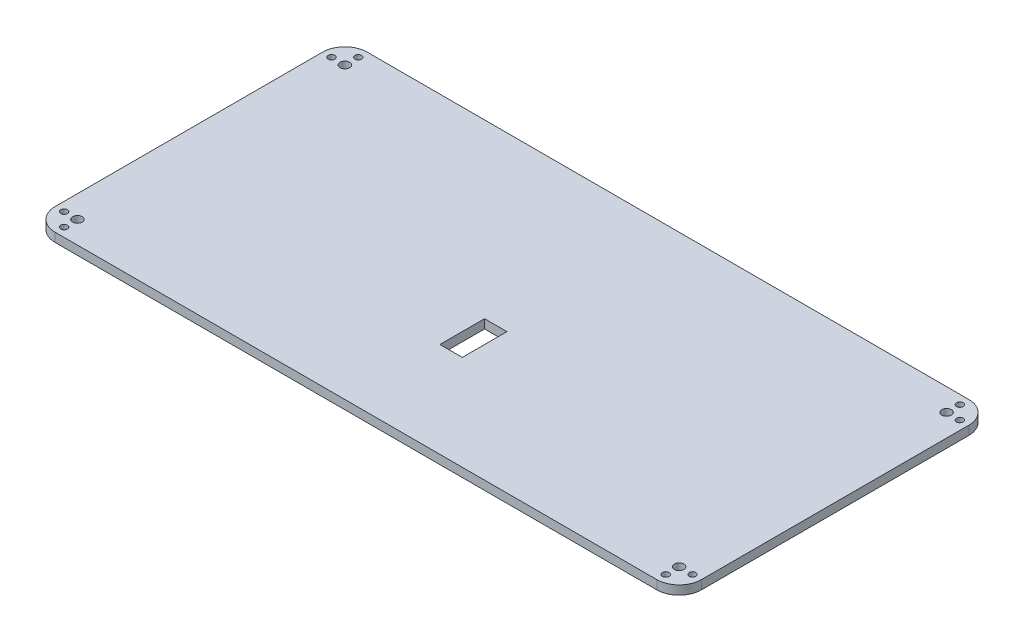
from build123d import *

# Parameters (mm, degrees)
SKETCH1_R               = 1.5
BOSS_EXTRUDE1_DEPTH     = 4
MIRROR2_COPY_1_SKETCH_R = 1.5
MIRROR2_COPY_1_DEPTH    = 4
MIRROR2_COPY_2_SKETCH_R = 1.5
MIRROR2_COPY_2_DEPTH    = 4
SKETCH2_W               = 10.05
SKETCH2_H               = 20.05
CUT_EXTRUDE5_DEPTH      = 162.062099825


with BuildPart() as part:
    # Sketch1 → Boss-Extrude1 (new body)
    with BuildSketch(Plane(origin=(0, 0, 0), x_dir=(1, 0, 0), z_dir=(0, 1, 0))):
        with BuildLine():
            Line((145, -60), (145, 0))
            Line((145, 0), (0, 0))
            Line((0, 0), (0, -70))
            Line((0, -70), (135, -70))
            ThreePointArc((135, -70), (142.071067812, -67.071067812), (145, -60))
        make_face()
        with Locations((135, -66)):
            Circle(SKETCH1_R, mode=Mode.SUBTRACT)
        with BuildLine():
            ThreePointArc((137.15, -60), (133.47972042, -61.52027958), (135, -57.85))
            ThreePointArc((135, -57.85), (136.52027958, -58.47972042), (137.15, -60))
        make_face(mode=Mode.SUBTRACT)
        with Locations((141, -60)):
            Circle(SKETCH1_R, mode=Mode.SUBTRACT)
    boss_extrude1 = extrude(amount=BOSS_EXTRUDE1_DEPTH)

    # Mirror1: Boss-Extrude1 across plane
    add(boss_extrude1.mirror(Plane(origin=(0, 0, 0), x_dir=(0, 0, 1), z_dir=(1, 0, 0))))

    # Mirror2 copy 1 sketch → Mirror2 copy 1 (add)
    with BuildSketch(Plane(origin=(0, 0, 0), x_dir=(-1, 0, 0), z_dir=(0, 1, 0))):
        with BuildLine():
            Line((145, -60), (145, 0))
            Line((145, 0), (0, 0))
            Line((0, 0), (0, -70))
            Line((0, -70), (135, -70))
            ThreePointArc((135, -70), (142.071067812, -67.071067812), (145, -60))
        make_face()
        with Locations((135, -66)):
            Circle(MIRROR2_COPY_1_SKETCH_R, mode=Mode.SUBTRACT)
        with BuildLine():
            ThreePointArc((137.15, -60), (133.47972042, -61.52027958), (135, -57.85))
            ThreePointArc((135, -57.85), (136.52027958, -58.47972042), (137.15, -60))
        make_face(mode=Mode.SUBTRACT)
        with Locations((141, -60)):
            Circle(MIRROR2_COPY_1_SKETCH_R, mode=Mode.SUBTRACT)
    extrude(amount=MIRROR2_COPY_1_DEPTH)

    # Mirror2 copy 2 sketch → Mirror2 copy 2 (add)
    with BuildSketch(Plane(origin=(0, 0, 0), x_dir=(1, 0, 0), z_dir=(0, 1, 0))):
        with BuildLine():
            Line((145, 60), (145, 0))
            Line((145, 0), (0, 0))
            Line((0, 0), (0, 70))
            Line((0, 70), (135, 70))
            ThreePointArc((135, 70), (142.071067812, 67.071067812), (145, 60))
        make_face()
        with Locations((135, 66)):
            Circle(MIRROR2_COPY_2_SKETCH_R, mode=Mode.SUBTRACT)
        with BuildLine():
            ThreePointArc((137.15, 60), (133.47972042, 61.52027958), (135, 57.85))
            ThreePointArc((135, 57.85), (136.52027958, 58.47972042), (137.15, 60))
        make_face(mode=Mode.SUBTRACT)
        with Locations((141, 60)):
            Circle(MIRROR2_COPY_2_SKETCH_R, mode=Mode.SUBTRACT)
    extrude(amount=MIRROR2_COPY_2_DEPTH)

    # Sketch2 → Cut-Extrude5 (cut, through all)
    with BuildSketch(Plane(origin=(0, 4, 0), x_dir=(1, 0, 0), z_dir=(0, 1, 0))):
        with Locations((-0.025, -17.284138883)):
            Rectangle(SKETCH2_W, SKETCH2_H)
    extrude(amount=-CUT_EXTRUDE5_DEPTH, mode=Mode.SUBTRACT)


solid = part.part
